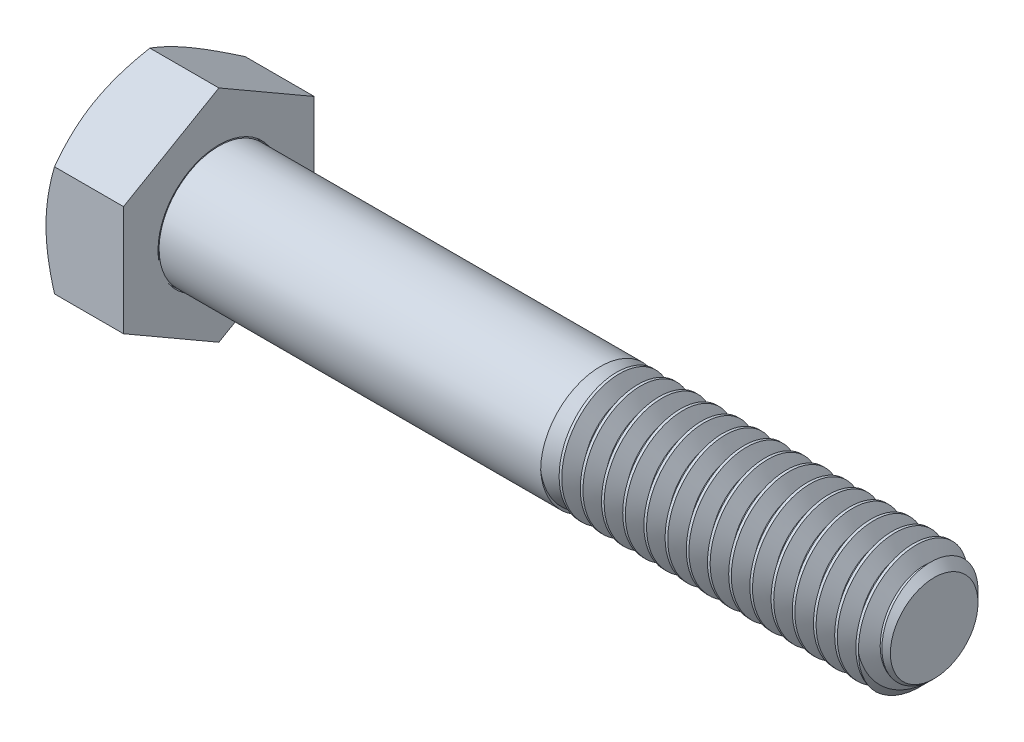
from build123d import *
from build123d.topology import SkipClean

# Parameters (mm, degrees)
SKETCH2_R           = 3.9751
BOSS_EXTRUDE1_DEPTH = 47.625
CHAMFER1_SIZE       = 1.058333333
BOSS_EXTRUDE2_DEPTH = 5.159375
SKETCH6_OUTSIDE_W   = 215.324
SKETCH6_OUTSIDE_H   = 217.288
SKETCH6_OUTSIDE_R   = 6.35
CUT_EXTRUDE1_DEPTH  = 54.668203598
CUT_EXTRUDE1_DRAFT  = -60
CUT_SWEEP1_PITCH    = 1.411111111


with BuildPart() as part:
    # Sketch2 → Boss-Extrude1 (new body)
    with BuildSketch(Plane(origin=(26.3921875, 0, 0), x_dir=(0, 0, -1), z_dir=(1, 0, 0))):
        Circle(SKETCH2_R)
    extrude(amount=-BOSS_EXTRUDE1_DEPTH)

    # Chamfer1
    chamfer1_edges = [part.edges().sort_by_distance(p)[0] for p in [
        (26.3921875, 0, 3.9751),
    ]]
    chamfer(chamfer1_edges, length=CHAMFER1_SIZE)

    # Sketch3 → Boss-Extrude2 (add)
    with BuildSketch(Plane.ZY.offset(21.2328125)):
        Polygon((-6.35, -3.666174209), (0, -7.332348419), (6.35, -3.666174209), (6.35, 3.666174209), (0, 7.332348419), (-6.35, 3.666174209), align=None)
    extrude(amount=BOSS_EXTRUDE2_DEPTH)


with BuildPart() as cut_extrude1_tool:
    # Sketch6 outside → Cut-Extrude1 (with draft: the straight prism first)
    with BuildSketch(Plane.ZY.offset(26.3921875)):
        Rectangle(SKETCH6_OUTSIDE_W, SKETCH6_OUTSIDE_H)
        Circle(SKETCH6_OUTSIDE_R, mode=Mode.SUBTRACT)
    extrude(amount=-CUT_EXTRUDE1_DEPTH)
    # Cut-Extrude1: the draft: its side faces are tilted about the plane it starts from
    cut_extrude1_sides = [cut_extrude1_tool.faces().sort_by_distance(p)[0] for p in [
        (0.941914299, -108.644, 0),
        (0.941914299, 0, 107.662),
        (0.941914299, 108.644, 0),
        (0.941914299, 0, -107.662),
        (0.941914299, 0, -6.35),
    ]]
    draft(cut_extrude1_sides, Plane.ZY.offset(26.3921875), CUT_EXTRUDE1_DRAFT)


with BuildPart() as part_1:
    add(part.part)

    # Cut-Extrude1: cut by cut_extrude1_tool
    add(cut_extrude1_tool.part, mode=Mode.SUBTRACT)

    # Cut-Sweep1: the profile of Sketch5 screwed along a right-hand helix of 34.75 turns, 8 arcs to a turn; built about Z, then put on its axis
    cut_sweep1_z = Axis((0, 0, 0), (0, 0, 1))
    cut_sweep1_corners = [(3.9751, 0, 0), (3.058556448, 0, -0.529166667), (3.058556448, 0, -0.705555556), (3.9751, 0, -1.234722222), (4.051478629, 0, -1.278819444), (4.051478629, 0, 0.044097222)]
    with BuildLine(mode=Mode.PRIVATE) as cut_sweep1_profile:
        Line(cut_sweep1_corners[0], cut_sweep1_corners[1])
        Line(cut_sweep1_corners[1], cut_sweep1_corners[2])
        Line(cut_sweep1_corners[2], cut_sweep1_corners[3])
        Line(cut_sweep1_corners[3], cut_sweep1_corners[4])
        Line(cut_sweep1_corners[4], cut_sweep1_corners[5])
        Line(cut_sweep1_corners[5], cut_sweep1_corners[0])
    cut_sweep1_cap = Face(cut_sweep1_profile.wire())
    cut_sweep1_turn_angles = [0, 22.5, 45, 67.5, 90, 112.5, 135, 157.5, 180, 202.5, 225, 247.5, 270, 292.5, 315, 337.5, 360]
    cut_sweep1_turn_weights = [1, 0.9238795325112867, 1, 0.9238795325112867, 1, 0.9238795325112867, 1, 0.9238795325112867, 1, 0.9238795325112867, 1, 0.9238795325112867, 1, 0.9238795325112867, 1, 0.9238795325112867, 1]
    cut_sweep1_turn_rails = [Edge.make_bspline([Vector(p[0], p[1], 0).rotate(cut_sweep1_z, cut_sweep1_turn_angles[k]) / cut_sweep1_turn_weights[k] + Vector(0, 0, p[2] + CUT_SWEEP1_PITCH * cut_sweep1_turn_angles[k] / 360) for k in range(17)], [0, 0, 0, 1, 1, 2, 2, 3, 3, 4, 4, 5, 5, 6, 6, 7, 7, 8, 8, 8], 2, cut_sweep1_turn_weights) for p in cut_sweep1_corners]
    cut_sweep1_turn_sides = [Face.make_surface_from_curves(cut_sweep1_turn_rails[p[0]], cut_sweep1_turn_rails[p[1]]) for p in [(0, 1), (1, 2), (2, 3), (3, 4), (4, 5), (5, 0)]]
    cut_sweep1_last_angles = [12240, 12262.5, 12285, 12307.5, 12330, 12352.5, 12375, 12397.5, 12420, 12442.5, 12465, 12487.5, 12510]
    cut_sweep1_last_weights = [1, 0.9238795325112867, 1, 0.9238795325112867, 1, 0.9238795325112867, 1, 0.9238795325112867, 1, 0.9238795325112867, 1, 0.9238795325118759, 1]
    cut_sweep1_last_rails = [Edge.make_bspline([Vector(p[0], p[1], 0).rotate(cut_sweep1_z, cut_sweep1_last_angles[k]) / cut_sweep1_last_weights[k] + Vector(0, 0, p[2] + CUT_SWEEP1_PITCH * cut_sweep1_last_angles[k] / 360) for k in range(13)], [0, 0, 0, 1, 1, 2, 2, 3, 3, 4, 4, 5, 5, 6, 6, 6], 2, cut_sweep1_last_weights) for p in cut_sweep1_corners]
    cut_sweep1_last_sides = [Face.make_surface_from_curves(cut_sweep1_last_rails[p[0]], cut_sweep1_last_rails[p[1]]) for p in [(0, 1), (1, 2), (2, 3), (3, 4), (4, 5), (5, 0)]]
    cut_sweep1 = Plane(origin=(26.3921875, 0, 0), x_dir=(0, 1, 0), z_dir=(-1, 0, 0)) * Solid(Shell([*[p.moved(Location((0, 0, CUT_SWEEP1_PITCH * i))) for i in range(34) for p in cut_sweep1_turn_sides], *cut_sweep1_last_sides, cut_sweep1_cap, cut_sweep1_cap.rotate(cut_sweep1_z, 12510).moved(Location((0, 0, CUT_SWEEP1_PITCH * 12510 / 360)))]))
    add(cut_sweep1, mode=Mode.SUBTRACT)

    # Sketch8 → Min Thread (revolve)
    with SkipClean():  # the faces are left unmerged after this step: merging them gives an invalid solid
        with BuildSketch(Plane.XY, mode=Mode.PRIVATE) as min_thread_sk:
            Polygon((-21.2428125, 3.9751), (4.1671875, 3.9751), (11.052262665, 0), (-21.2428125, 0), align=None)
        revolve(min_thread_sk.sketch.rotate(Axis((-26.3921875, 0, 0), (1, 0, 0)), 135), axis=Axis((-26.3921875, 0, 0), (1, 0, 0)))


solid = part_1.part
